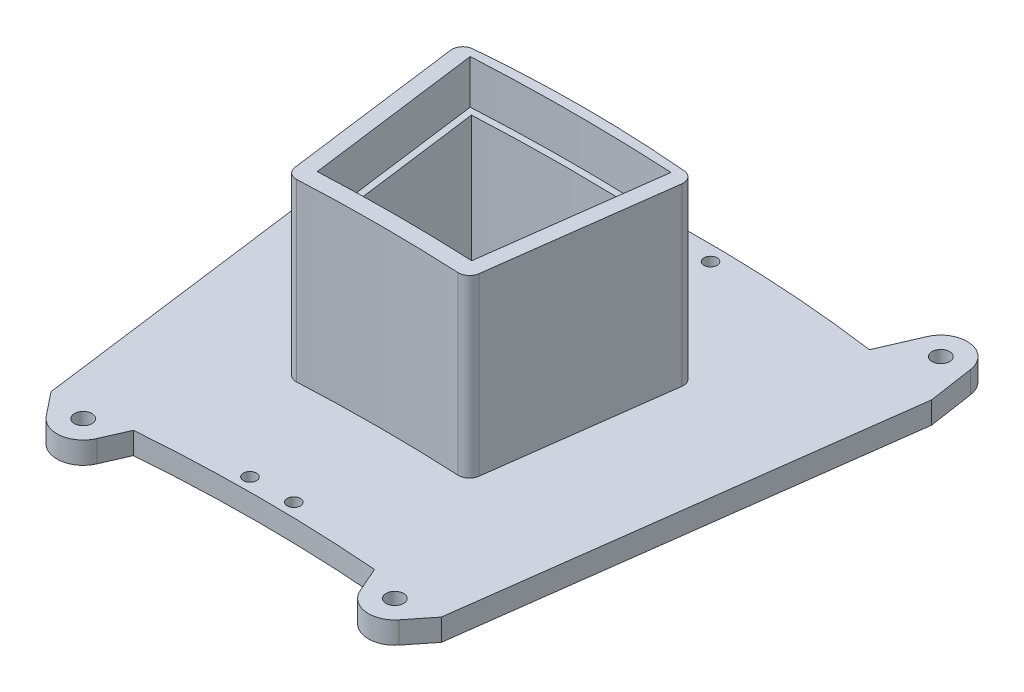
from build123d import *

# Parameters (mm, degrees)
SKETCH1_R               = 1.5
BOSS_EXTRUDE1_DEPTH     = 5
BOSS_EXTRUDE2_DEPTH     = 40
CUT_EXTRUDE1_DEPTH      = 91.434261951
BOSS_EXTRUDE3_START     = -5
BOSS_EXTRUDE3_OUTLINE_R = 2
BOSS_EXTRUDE3_DEPTH     = 5
CUT_EXTRUDE2_START      = -10
CUT_EXTRUDE2_DEPTH      = 10


# Read off the part's stored shape, not the designer's step: Boss-Extrude3
with BuildPart() as part:
    # Sketch1 → Boss-Extrude1 (new body)
    with BuildSketch(Plane(origin=(0, 0, 0), x_dir=(1, 0, 0), z_dir=(0, 1, 0))):
        with BuildLine():
            Line((-57.5, 45.38652637), (-44.5, -53.358277095))
            ThreePointArc((-44.5, -53.358277095), (0, -50.5), (44.5, -53.358277095))
            Line((44.5, -53.358277095), (57.5, 45.38652637))
            ThreePointArc((57.5, 45.38652637), (0, 51), (-57.5, 45.38652637))
        make_face()
        with Locations(Location((-5, 47.5, 0), (0, 0, 270))):
            Circle(SKETCH1_R, mode=Mode.SUBTRACT)
        with Locations(Location((-5, -47.5, 0), (0, 0, 270))):
            Circle(SKETCH1_R, mode=Mode.SUBTRACT)
        with Locations(Location((5, -47.5, 0), (0, 0, 90))):
            Circle(SKETCH1_R, mode=Mode.SUBTRACT)
        with Locations(Location((5, 47.5, 0), (0, 0, 90))):
            Circle(SKETCH1_R, mode=Mode.SUBTRACT)
    extrude(amount=BOSS_EXTRUDE1_DEPTH)

    # Sketch2 → Boss-Extrude2 (add)
    with BuildSketch(Plane(origin=(0, 5, 0), x_dir=(1, 0, 0), z_dir=(0, 1, 0))):
        with BuildLine():
            Line((-26.368366328, 19.603975201), (-20.985908119, -21.279853883))
            ThreePointArc((-20.985908119, -21.279853883), (-20.109118271, -22.872956361), (-18.384839881, -23.450537503))
            ThreePointArc((-18.384839881, -23.450537503), (0, -23), (18.384839881, -23.450537503))
            ThreePointArc((18.384839881, -23.450537503), (20.109118271, -22.872956361), (20.985908119, -21.279853883))
            Line((20.985908119, -21.279853883), (26.368366328, 19.603975201))
            ThreePointArc((26.368366328, 19.603975201), (25.841207036, 21.492926829), (24.11319073, 22.420285883))
            ThreePointArc((24.11319073, 22.420285883), (0, 23.5), (-24.11319073, 22.420285883))
            ThreePointArc((-24.11319073, 22.420285883), (-25.841207036, 21.492926829), (-26.368366328, 19.603975201))
        make_face()
    extrude(amount=BOSS_EXTRUDE2_DEPTH)

    # Sketch3 → Cut-Extrude1 (cut, through all)
    with BuildSketch(Plane(origin=(0, 0, 0), x_dir=(1, 0, 0), z_dir=(0, 1, 0))):
        with BuildLine():
            Line((-21.18897611, 19.181297446), (-16.295136113, -17.99110784))
            ThreePointArc((-16.295136113, -17.99110784), (0, -17.643611739), (16.295136113, -17.99110784))
            Line((16.295136113, -17.99110784), (21.18897611, 19.181297446))
            ThreePointArc((21.18897611, 19.181297446), (0, 19.717805469), (-21.18897611, 19.181297446))
        make_face()
    extrude(amount=CUT_EXTRUDE1_DEPTH, mode=Mode.SUBTRACT)

    # Boss-Extrude3 outline → Boss-Extrude3 (add)
    # profile 1 of 4: a face of its own
    with BuildSketch(Plane.XZ.offset(BOSS_EXTRUDE3_START)):
        with BuildLine():
            Line((-44.496886412, -57.390761561), (-40.51552272, -48.226360981))
            ThreePointArc((-40.51552272, -48.226360981), (-49.028326901, -46.92944202), (-57.5, -45.38652637))
            Line((-57.5, -45.38652637), (-55.934374164, -55.884987732))
            ThreePointArc((-55.934374164, -55.884987732), (-50.783157153, -60.948669168), (-44.496886412, -57.390761561))
        make_face()
        with Locations((-50, -55)):
            Circle(BOSS_EXTRUDE3_OUTLINE_R, mode=Mode.SUBTRACT)
    # profile 2 of 4: a face of its own
    with BuildSketch(Plane.XZ.offset(BOSS_EXTRUDE3_START)):
        with BuildLine():
            Line((40.51552272, -48.226360981), (44.496886412, -57.390761561))
            ThreePointArc((44.496886412, -57.390761561), (50.783157153, -60.948669168), (55.934374164, -55.884987732))
            Line((55.934374164, -55.884987732), (57.5, -45.38652637))
            ThreePointArc((57.5, -45.38652637), (49.028326901, -46.92944202), (40.51552272, -48.226360981))
        make_face()
        with Locations((50, -55)):
            Circle(BOSS_EXTRUDE3_OUTLINE_R, mode=Mode.SUBTRACT)
    # profile 3 of 4: a face of its own
    with BuildSketch(Plane.XZ.offset(BOSS_EXTRUDE3_START)):
        with BuildLine():
            Line((44.5, 53.358277095), (40.209954991, 58.740009651))
            ThreePointArc((40.209954991, 58.740009651), (34.735068112, 60.948669168), (30.018376627, 57.398262905))
            Line((30.018376627, 57.398262905), (27.484562868, 51.587560448))
            ThreePointArc((27.484562868, 51.587560448), (36.003169058, 52.368295779), (44.5, 53.358277095))
        make_face()
        with Locations((35.518225265, 55)):
            Circle(BOSS_EXTRUDE3_OUTLINE_R, mode=Mode.SUBTRACT)
    # profile 4 of 4: a face of its own
    with BuildSketch(Plane.XZ.offset(BOSS_EXTRUDE3_START)):
        with BuildLine():
            ThreePointArc((-44.5, 53.358277095), (-36.003169058, 52.368295779), (-27.484562868, 51.587560448))
            Line((-27.484562868, 51.587560448), (-30.018376627, 57.398262905))
            ThreePointArc((-30.018376627, 57.398262905), (-34.735068112, 60.948669168), (-40.209954991, 58.740009651))
            Line((-40.209954991, 58.740009651), (-44.5, 53.358277095))
        make_face()
        with Locations((-35.518225265, 55)):
            Circle(BOSS_EXTRUDE3_OUTLINE_R, mode=Mode.SUBTRACT)
    extrude(amount=BOSS_EXTRUDE3_DEPTH)

    # Sketch9 → Cut-Extrude2 (cut)
    with BuildSketch(Plane(origin=(0, 45, 0), x_dir=(1, 0, 0), z_dir=(0, 1, 0)).offset(CUT_EXTRUDE2_START)):
        with BuildLine():
            Line((17.602749325, -19.55074577), (22.887903449, 20.593985408))
            ThreePointArc((22.887903449, 20.593985408), (0, 21.217805469), (-22.887903449, 20.593985408))
            Line((-22.887903449, 20.593985408), (-17.602749325, -19.55074577))
            ThreePointArc((-17.602749325, -19.55074577), (0, -19.143611739), (17.602749325, -19.55074577))
        make_face()
        with BuildLine():
            Line((16.295136113, -17.99110784), (21.18897611, 19.181297446))
            ThreePointArc((21.18897611, 19.181297446), (0, 19.717805469), (-21.18897611, 19.181297446))
            Line((-21.18897611, 19.181297446), (-16.295136113, -17.99110784))
            ThreePointArc((-16.295136113, -17.99110784), (0, -17.643611739), (16.295136113, -17.99110784))
        make_face(mode=Mode.SUBTRACT)
    extrude(amount=CUT_EXTRUDE2_DEPTH, mode=Mode.SUBTRACT)


solid = part.part
